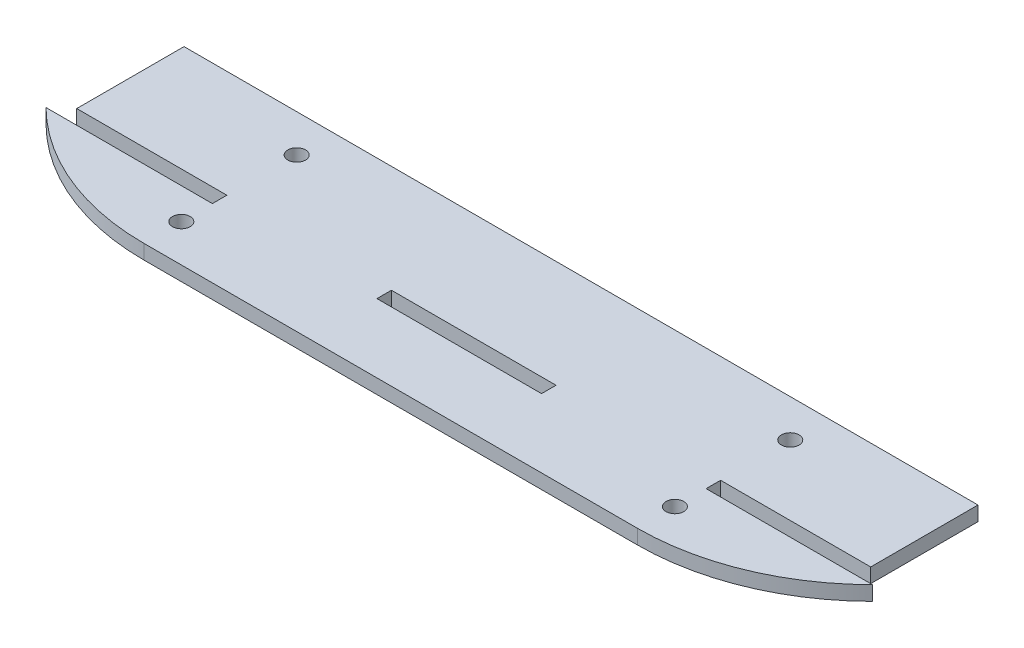
from build123d import *

# Parameters (mm, degrees)
SKETCH1_R           = 1.65
SKETCH1_W           = 30.68
SKETCH1_H           = 2.7
BOSS_EXTRUDE1_DEPTH = 2.7


with BuildPart() as part:
    # Sketch1 → Boss-Extrude1 (new body)
    with BuildSketch(Plane(origin=(0, 0, 0), x_dir=(1, 0, 0), z_dir=(0, 1, 0))):
        with BuildLine():
            Line((-46, 0), (46, 0))
            ThreePointArc((46, 0), (62.780941571, 3.32568378), (77.025151087, 12.8))
            Line((77.025151087, 12.8), (46.015151087, 12.8))
            Line((46.015151087, 12.8), (46.015151087, 15.5))
            Line((46.015151087, 15.5), (73.995151087, 15.5))
            Line((73.995151087, 15.5), (73.995151087, 35.5))
            Line((73.995151087, 35.5), (-73.995151087, 35.5))
            Line((-73.995151087, 35.5), (-73.995151087, 15.5))
            Line((-73.995151087, 15.5), (-46.015151087, 15.5))
            Line((-46.015151087, 15.5), (-46.015151087, 12.8))
            Line((-46.015151087, 12.8), (-77.025151087, 12.8))
            ThreePointArc((-77.025151087, 12.8), (-62.780941571, 3.32568378), (-46, 0))
        make_face()
        with Locations((46, 28.5)):
            Circle(SKETCH1_R, mode=Mode.SUBTRACT)
        with Locations((46, 7)):
            Circle(SKETCH1_R, mode=Mode.SUBTRACT)
        with Locations((-46, 7)):
            Circle(SKETCH1_R, mode=Mode.SUBTRACT)
        with Locations((-46, 28.5)):
            Circle(SKETCH1_R, mode=Mode.SUBTRACT)
        with Locations((0, 14.15)):
            Rectangle(SKETCH1_W, SKETCH1_H, mode=Mode.SUBTRACT)
    extrude(amount=BOSS_EXTRUDE1_DEPTH)


solid = part.part
